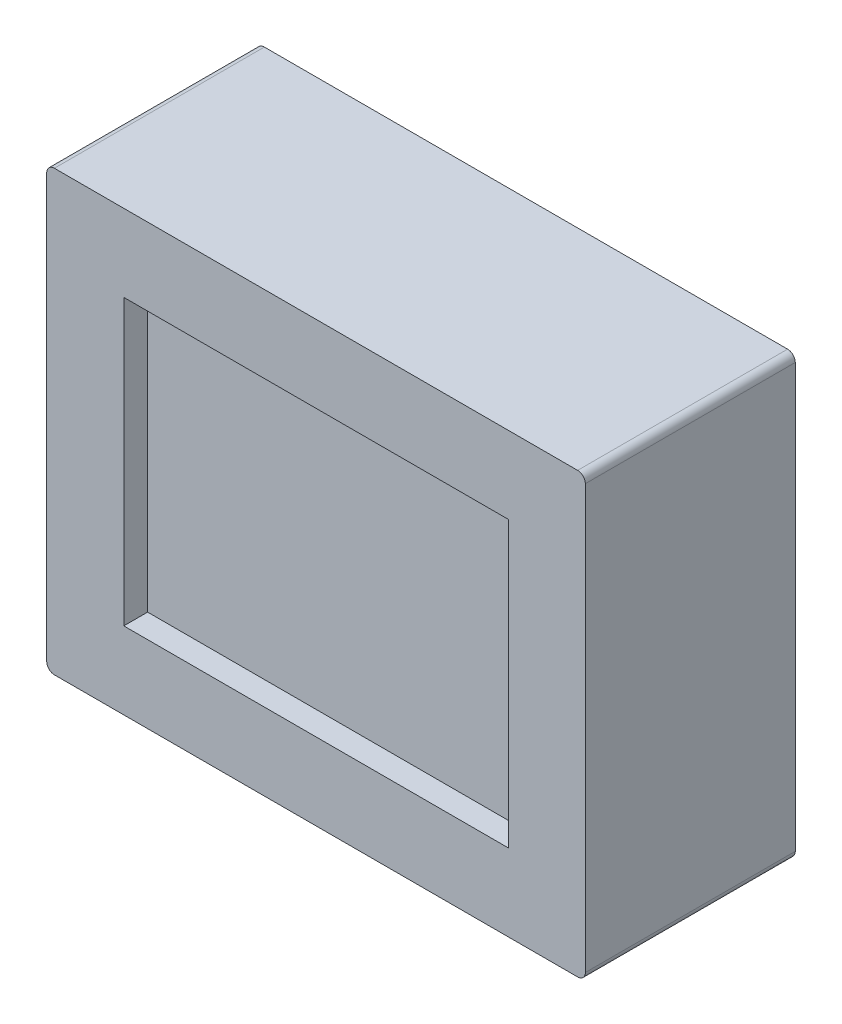
from build123d import *

# Parameters (mm, degrees)
MAIN_FEATURES_SKETCH_W   = 70.04
MAIN_FEATURES_SKETCH_H   = 57.05
MAIN_BODY_DEPTH          = 27.3
WIRES_START              = 2.1
MAIN_FEATURES_SKETCH_3_W = 4
MAIN_FEATURES_SKETCH_3_H = 10
WIRES_2_DEPTH            = 4
LENS_CUTOUT_START        = 27.3
MAIN_FEATURES_SKETCH_4_W = 50
MAIN_FEATURES_SKETCH_4_H = 37
LENS_CUTOUT_DEPTH        = 3.1
MAIN_FEATURES_SKETCH_5_R = 2.25
SCREW_HEADS_DEPTH        = 0.3
FILLET1_R                = 1
FILLET2_R                = 2


with BuildPart() as part:
    # main_features_sketch → main_body (new body)
    with BuildSketch(Plane.XY):
        Rectangle(MAIN_FEATURES_SKETCH_W, MAIN_FEATURES_SKETCH_H)
    extrude(amount=MAIN_BODY_DEPTH)

    # main_features_sketch<3> → wires 2 (add)
    with BuildSketch(Plane.XY.offset(WIRES_START)):
        with Locations((-18, -33.525)):
            Rectangle(MAIN_FEATURES_SKETCH_3_W, MAIN_FEATURES_SKETCH_3_H)
        with Locations((18, -33.525)):
            Rectangle(MAIN_FEATURES_SKETCH_3_W, MAIN_FEATURES_SKETCH_3_H)
    extrude(amount=WIRES_2_DEPTH)

    # main_features_sketch<4> → lens_cutout (cut)
    with BuildSketch(Plane.XY.offset(LENS_CUTOUT_START)):
        Rectangle(MAIN_FEATURES_SKETCH_4_W, MAIN_FEATURES_SKETCH_4_H)
    extrude(amount=-LENS_CUTOUT_DEPTH, mode=Mode.SUBTRACT)

    # main_features_sketch<5> → screw_heads (add)
    with BuildSketch(Plane.XY):
        with Locations((-32, -25.5)):
            Circle(MAIN_FEATURES_SKETCH_5_R)
        with Locations((32, -25.5)):
            Circle(MAIN_FEATURES_SKETCH_5_R)
        with Locations((32, 25.5)):
            Circle(MAIN_FEATURES_SKETCH_5_R)
        with Locations((-32, 25.5)):
            Circle(MAIN_FEATURES_SKETCH_5_R)
    extrude(amount=-SCREW_HEADS_DEPTH)

    # Fillet1
    fillet1_edges = [part.edges().sort_by_distance(p)[0] for p in [
        (35.02, 28.525, 13.65),
        (35.02, -28.525, 13.65),
        (-35.02, -28.525, 13.65),
        (-35.02, 28.525, 13.65),
    ]]
    fillet(fillet1_edges, radius=FILLET1_R)

    # Fillet2
    fillet2_edges = [part.edges().sort_by_distance(p)[0] for p in [
        (20, -33.525, 2.1),
        (20, -33.525, 6.1),
        (16, -33.525, 2.1),
        (16, -33.525, 6.1),
        (-16, -33.525, 2.1),
        (-16, -33.525, 6.1),
        (-20, -33.525, 2.1),
        (-20, -33.525, 6.1),
    ]]
    fillet(fillet2_edges, radius=FILLET2_R - 0.0001)  # a hair under: the kernel refuses the full size


solid = part.part
